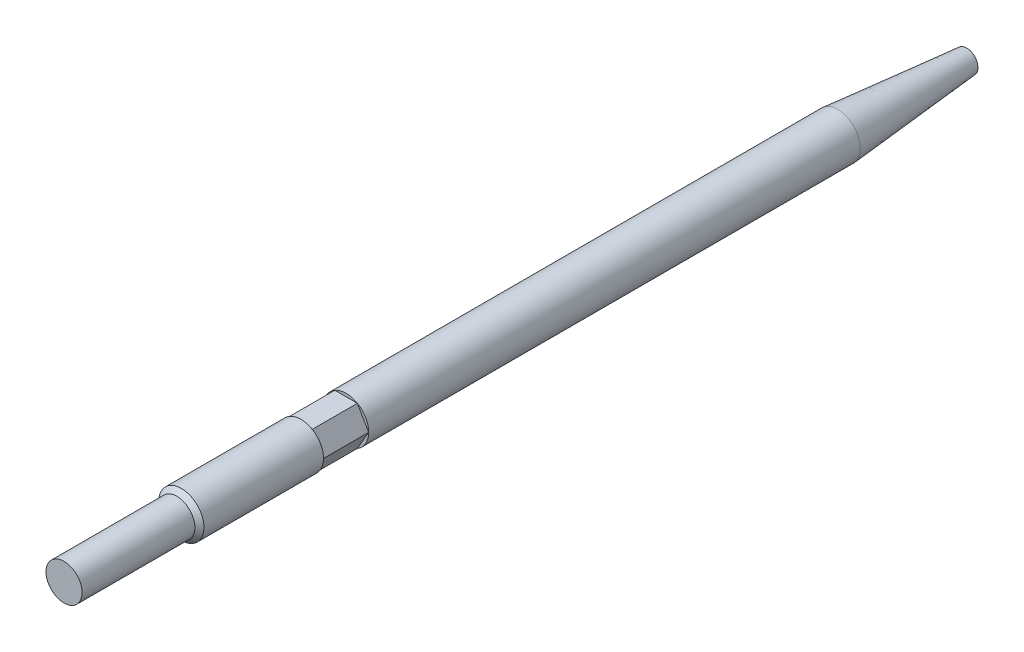
from build123d import *

# Parameters (mm, degrees)
SKETCH1_R          = 10
EXTRUDE1_DEPTH     = 500
CHAMFER1_SIZE      = 2
SKETCH2_R          = 43.013092774
SKETCH2_R_2        = 8
CUT_EXTRUDE1_DEPTH = 50
CHAMFER2_SIZE      = 2
SKETCH3_R          = 224.622331413
REMOVE_DEPTH       = 600
SKETCH4_R          = 20
HEX_2_DEPTH        = 20
CHAMFER3_SIZE      = 5
CHAMFER3_SIZE2     = 57.150261514


with BuildPart() as part:
    # Sketch1 → Extrude1 (new, symmetric)
    with BuildSketch(Plane.XY):
        Circle(SKETCH1_R)
    extrude(amount=EXTRUDE1_DEPTH, both=True)

    # Chamfer1
    chamfer1_edges = [part.edges().sort_by_distance(p)[0] for p in [
        (-10, 0, -500),
        (-10, 0, 500),
    ]]
    chamfer(chamfer1_edges, length=CHAMFER1_SIZE)

    # Sketch2 → Cut-Extrude1 (cut)
    with BuildSketch(Plane.XY.offset(500)):
        Circle(SKETCH2_R)
        Circle(SKETCH2_R_2, mode=Mode.SUBTRACT)
    extrude(amount=-CUT_EXTRUDE1_DEPTH, mode=Mode.SUBTRACT)

    # Chamfer2
    chamfer2_edges = [part.edges().sort_by_distance(p)[0] for p in [
        (-10, 0, 450),
    ]]
    chamfer(chamfer2_edges, length=CHAMFER2_SIZE - 0.0001)  # a hair under: the kernel refuses the full size

    # Sketch3 → remove (cut)
    with BuildSketch(Plane(origin=(0, 0, -500), x_dir=(-1, 0, 0), z_dir=(0, 0, -1))):
        Circle(SKETCH3_R)
    extrude(amount=-REMOVE_DEPTH, mode=Mode.SUBTRACT)

    # Sketch4 → hex 2 (cut)
    with BuildSketch(Plane.XY.offset(395)):
        Circle(SKETCH4_R)
        Polygon((5, 8.660254038), (-5, 8.660254038), (-10, 0), (-5, -8.660254038), (5, -8.660254038), (10, 0), align=None, mode=Mode.SUBTRACT)
    extrude(amount=-HEX_2_DEPTH, mode=Mode.SUBTRACT)

    # Chamfer3
    chamfer3_edges = [part.edges().sort_by_distance(p)[0] for p in [
        (-10, 0, 100),
    ]]
    chamfer3_side = [part.faces().sort_by_distance(p)[0] for p in [
        (0, 0, 100),
    ]]
    chamfer(chamfer3_edges, length=CHAMFER3_SIZE, length2=CHAMFER3_SIZE2, reference=chamfer3_side[0])


solid = part.part
